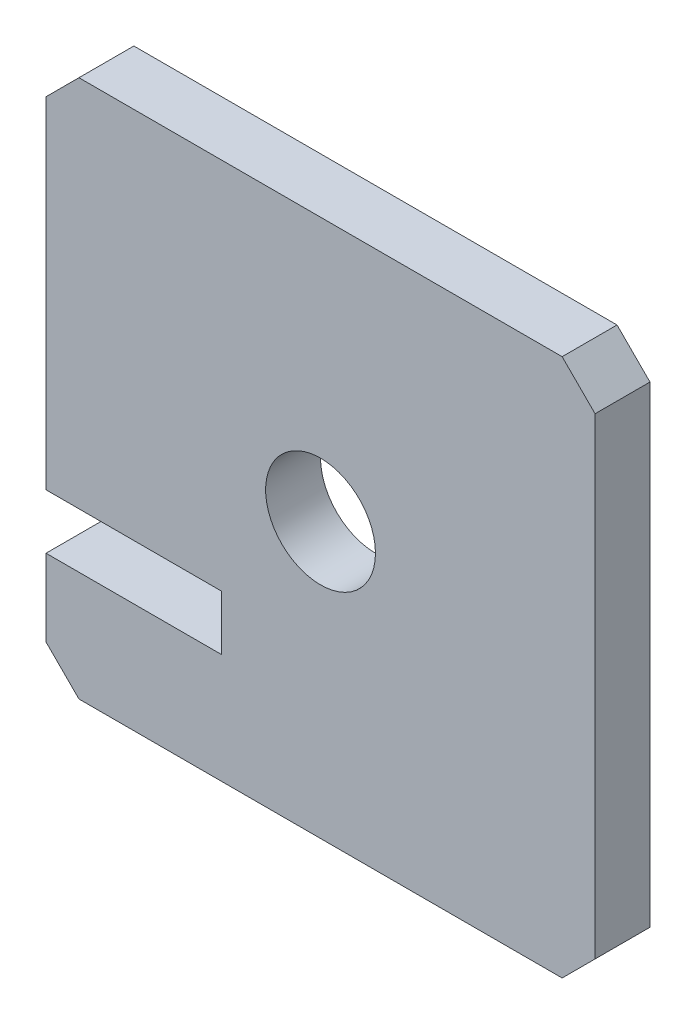
from build123d import *

# Parameters (mm, degrees)
SKETCH1_R           = 5
BOSS_EXTRUDE1_DEPTH = 5


with BuildPart() as part:
    # Sketch1 → Boss-Extrude1 (new body)
    with BuildSketch(Plane.XY):
        Polygon((-22, 24), (22, 24), (25, 21), (25, -22), (22, -25), (-22, -25), (-25, -22), (-25, -15), (-9, -15), (-9, -10), (-25, -10), (-25, 21), align=None)
        Circle(SKETCH1_R, mode=Mode.SUBTRACT)
    extrude(amount=BOSS_EXTRUDE1_DEPTH)


solid = part.part
